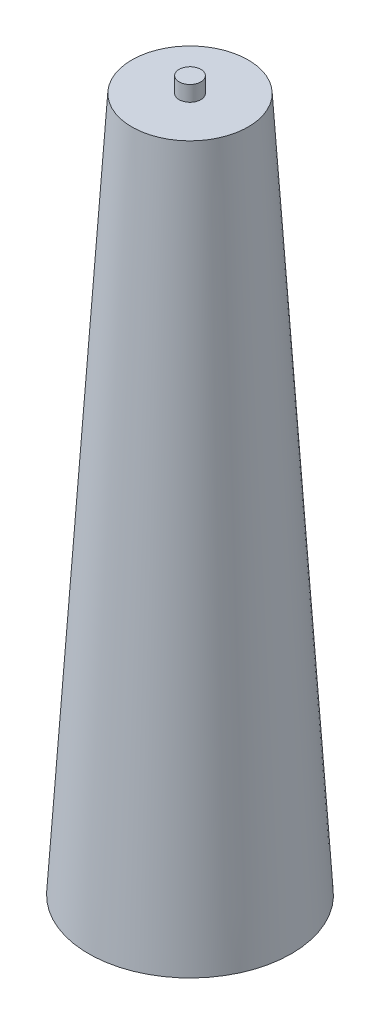
from build123d import *

# Parameters (mm, degrees)
SKETCH2_R           = 3.5814
BOSS_EXTRUDE1_DEPTH = 5.08
SKETCH3_R           = 3.5814
CUT_EXTRUDE1_DEPTH  = 5.08


# Read off the part's stored shape, not the designer's step: Shell3
with BuildPart() as part:
    # Sketch1 → Revolve1 (revolve)
    with BuildSketch(Plane.XY):
        Polygon((0, 0), (-33.401, 0), (-19.138871581, 228.6), (0, 228.6), align=None)
    revolve(axis=Axis((0, 228.6, 0), (0, -1, 0)))

    # Sketch2 → Boss-Extrude1 (add)
    with BuildSketch(Plane(origin=(0, 228.6, 0), x_dir=(1, 0, 0), z_dir=(0, 1, 0))):
        with Locations(Location((0, 0, 0), (0, 0, 180))):
            Circle(SKETCH2_R)
    extrude(amount=BOSS_EXTRUDE1_DEPTH)

    # Sketch3 → Cut-Extrude1 (cut)
    with BuildSketch(Plane.XZ):
        with Locations(Location((0, 0, 0), (0, 0, 180))):
            Circle(SKETCH3_R)
    extrude(amount=-CUT_EXTRUDE1_DEPTH, mode=Mode.SUBTRACT)

    # Shell3 outline → Shell3 (revolve, cut)
    with BuildSketch(Plane.XY):
        Polygon((6.1214, 7.62), (6.1214, 2.54), (30.697593373, 2.54), (16.752401141, 226.06), (1.0414, 226.06), (1.0414, 231.14), (0, 231.14), (0, 7.62), align=None)
    revolve(axis=Axis((0, 0, 0), (0, 1, 0)), mode=Mode.SUBTRACT)


solid = part.part
